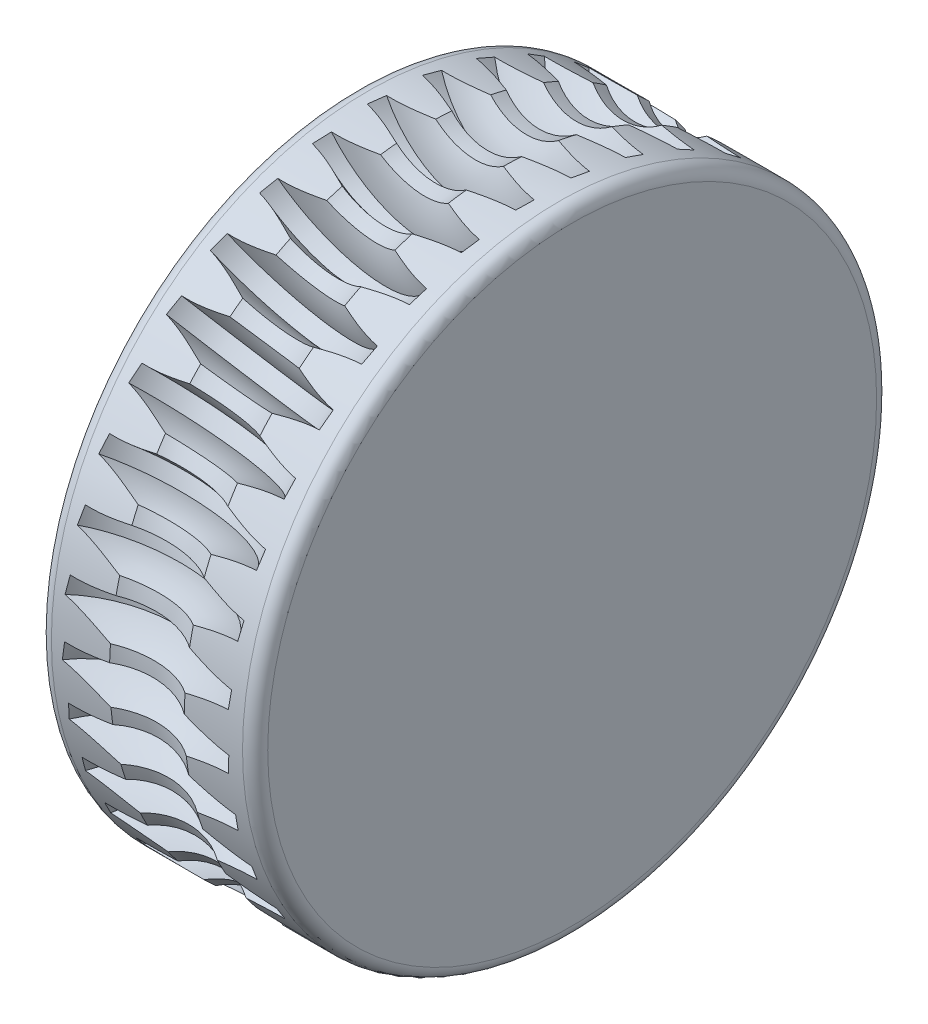
from build123d import *

# Parameters (mm, degrees)
CIRPATTERN1_COUNT = 36


with BuildPart() as part:
    # Sketch1 → Revolve1 (revolve)
    with BuildSketch(Plane.XY):
        with BuildLine():
            Line((-6.7385, 0), (6.7385, 0))
            Line((6.7385, 0), (6.7385, 18.96465))
            ThreePointArc((6.7385, 18.96465), (6.508461666, 19.520011666), (5.9531, 19.75005))
            Line((5.9531, 19.75005), (2.331914449, 19.75005))
            ThreePointArc((2.331914449, 19.75005), (0, 19), (-2.331914449, 19.75005))
            Line((-2.331914449, 19.75005), (-5.9531, 19.75005))
            ThreePointArc((-5.9531, 19.75005), (-6.508461666, 19.520011666), (-6.7385, 18.96465))
            Line((-6.7385, 18.96465), (-6.7385, 0))
        make_face()
    revolve(axis=Axis((-6.7385, 0, 0), (1, 0, 0)))

    # Sketch3 → Cut-Revolve1 (revolve, cut)
    with BuildSketch(Plane(origin=(0, 0, 0), x_dir=(0.09950383819980535, 0, -0.9950371782921014), z_dir=(0.9950371782921013, 0, 0.09950383819980534))):
        with BuildLine():
            ThreePointArc((1.328756927, 20.456891382), (-0.894483333, 20.480476058), (-3.107201887, 20.263151197))
            ThreePointArc((-3.107201887, 20.263151197), (-1.902129366, 18.674811705), (-1.265796168, 16.785340302))
            ThreePointArc((-1.265796168, 16.785340302), (-0.7344799, 16.816968463), (-0.202429288, 16.831782775))
            ThreePointArc((-0.202429288, 16.831782775), (0.266750087, 18.769537361), (1.328756927, 20.456891382))
        make_face()
    cut_revolve1 = revolve(axis=Axis((-1.451843071, 22.816968463, 14.518413145), (0.09950383819980535, 0, -0.9950371782921014)), mode=Mode.SUBTRACT)

    # CirPattern1: Cut-Revolve1 ×36 about axis
    cirpattern1_axis = Axis((6.7385, 0, 0), (1, 0, 0))
    for i in range(1, CIRPATTERN1_COUNT):
        add(cut_revolve1.rotate(cirpattern1_axis, i * 360 / CIRPATTERN1_COUNT), mode=Mode.SUBTRACT)


solid = part.part
